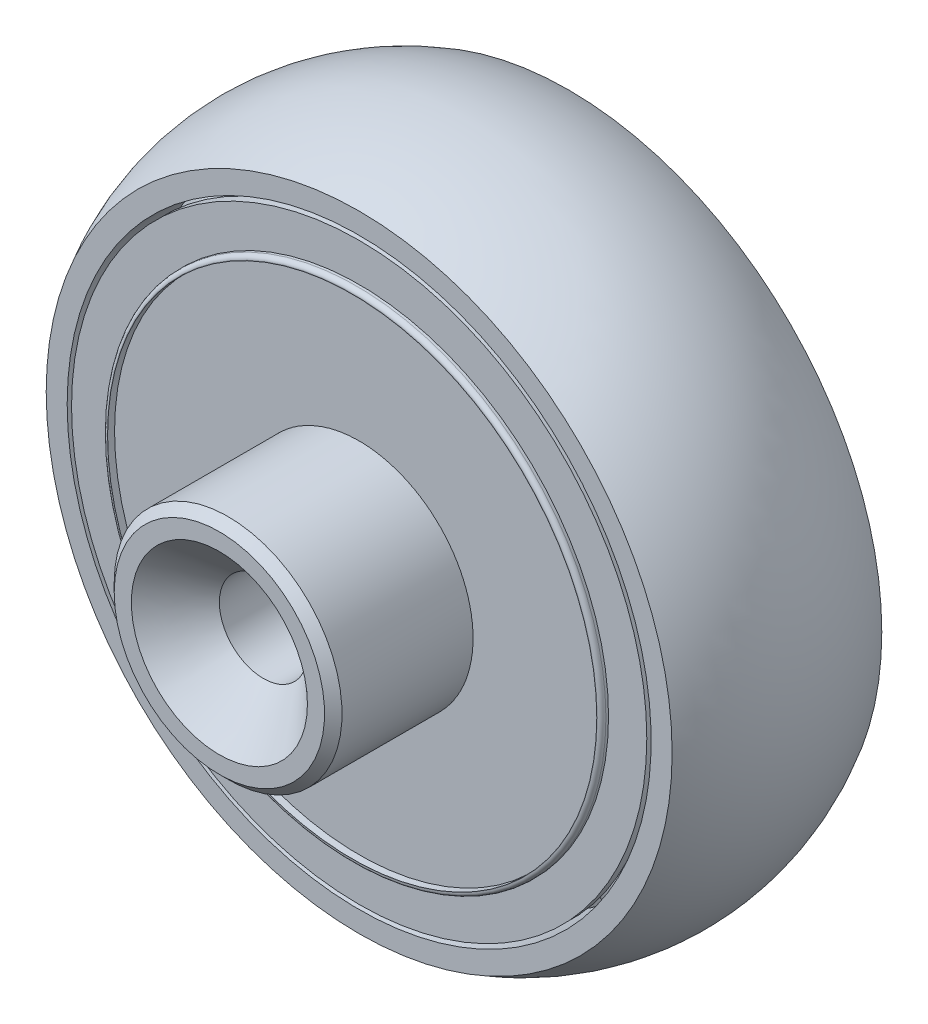
from build123d import *

# Parameters (mm, degrees)
CIRPATTERN1_COUNT   = 17
SKETCH4_W           = 38.1
SKETCH4_H           = 6.35
CHAMFER1_SIZE       = 3.999992
CHAMFER2_SIZE       = 0.79375
SKETCH6_R           = 26.13378187
SKETCH6_R_2         = 10.35
BOSS_EXTRUDE1_DEPTH = 0.79375
SKETCH7_R           = 22.6568
SKETCH7_R_2         = 22.225
BOSS_EXTRUDE2_DEPTH = 0.635
FILLET1_R           = 0.397002


with BuildPart() as part:
    # Sketch2 → Revolve1 (revolve)
    with BuildSketch(Plane(origin=(0, 0, 0), x_dir=(0, 0, -1), z_dir=(1, 0, 0))):
        with BuildLine():
            Line((3.58302091, 26.53078387), (9.525, 26.53078387))
            Line((9.525, 26.53078387), (9.525, 28.43578387))
            ThreePointArc((9.525, 28.43578387), (0, 30.987999928), (-9.525, 28.43578387))
            Line((-9.525, 28.43578387), (-9.525, 26.53078387))
            Line((-9.525, 26.53078387), (-3.58302091, 26.53078387))
            ThreePointArc((-3.58302091, 26.53078387), (0, 29.04538387), (3.58302091, 26.53078387))
        make_face()
    revolve(axis=Axis((0, 0, -65.165512717), (0, 0, 1)))

    # Sketch3 → Revolve2 (revolve)
    with BuildSketch(Plane(origin=(0, 0, 0), x_dir=(0, 0, -1), z_dir=(1, 0, 0))):
        with BuildLine():
            Line((4.207002, -25.23538387), (-4.207002, -25.23538387))
            ThreePointArc((-4.207002, -25.23538387), (0, -29.44238587), (4.207002, -25.23538387))
        make_face()
    revolve2 = revolve(axis=Axis((0, -25.23538387, -4.207002), (0, 0, 1)))

    # CirPattern1: Revolve2 ×17 about axis
    cirpattern1_axis = Axis((0, 0, 3.58302091), (0, 0, -1))
    for i in range(1, CIRPATTERN1_COUNT):
        add(revolve2.rotate(cirpattern1_axis, i * 360 / CIRPATTERN1_COUNT))


with BuildPart() as body_2:
    # Sketch4 → Revolve3 (revolve)
    with BuildSketch(Plane(origin=(0, 0, 0), x_dir=(0, 0, -1), z_dir=(1, 0, 0))):
        with Locations((-3.175, 7.175)):
            Rectangle(SKETCH4_W, SKETCH4_H)
    revolve(axis=Axis((0, 0, -10.4775), (0, 0, 1)))

    # Chamfer1
    chamfer1_edges = [body_2.edges().sort_by_distance(p)[0] for p in [
        (0, -4, 22.225),
        (0, -4, -15.875),
    ]]
    chamfer(chamfer1_edges, length=CHAMFER1_SIZE)

    # Chamfer2
    chamfer2_edges = [body_2.edges().sort_by_distance(p)[0] for p in [
        (0, -10.35, -15.875),
        (0, -10.35, 22.225),
    ]]
    chamfer(chamfer2_edges, length=CHAMFER2_SIZE)


with BuildPart() as body_3:
    # Sketch6 → Boss-Extrude1 (new body)
    with BuildSketch(Plane.XY.offset(9.525)):
        Circle(SKETCH6_R)
        Circle(SKETCH6_R_2, mode=Mode.SUBTRACT)
    extrude(amount=-BOSS_EXTRUDE1_DEPTH)


with BuildPart() as body_4:
    # Sketch7 → Boss-Extrude2 (new body)
    with BuildSketch(Plane.XY.offset(9.525)):
        Circle(SKETCH7_R)
        Circle(SKETCH7_R_2, mode=Mode.SUBTRACT)
    extrude(amount=BOSS_EXTRUDE2_DEPTH)

    # Fillet1
    fillet1_edges = [body_4.edges().sort_by_distance(p)[0] for p in [
        (-22.6568, 0, 10.16),
    ]]
    fillet(fillet1_edges, radius=FILLET1_R)


solid = Compound([part.part, body_2.part, body_3.part, body_4.part])
